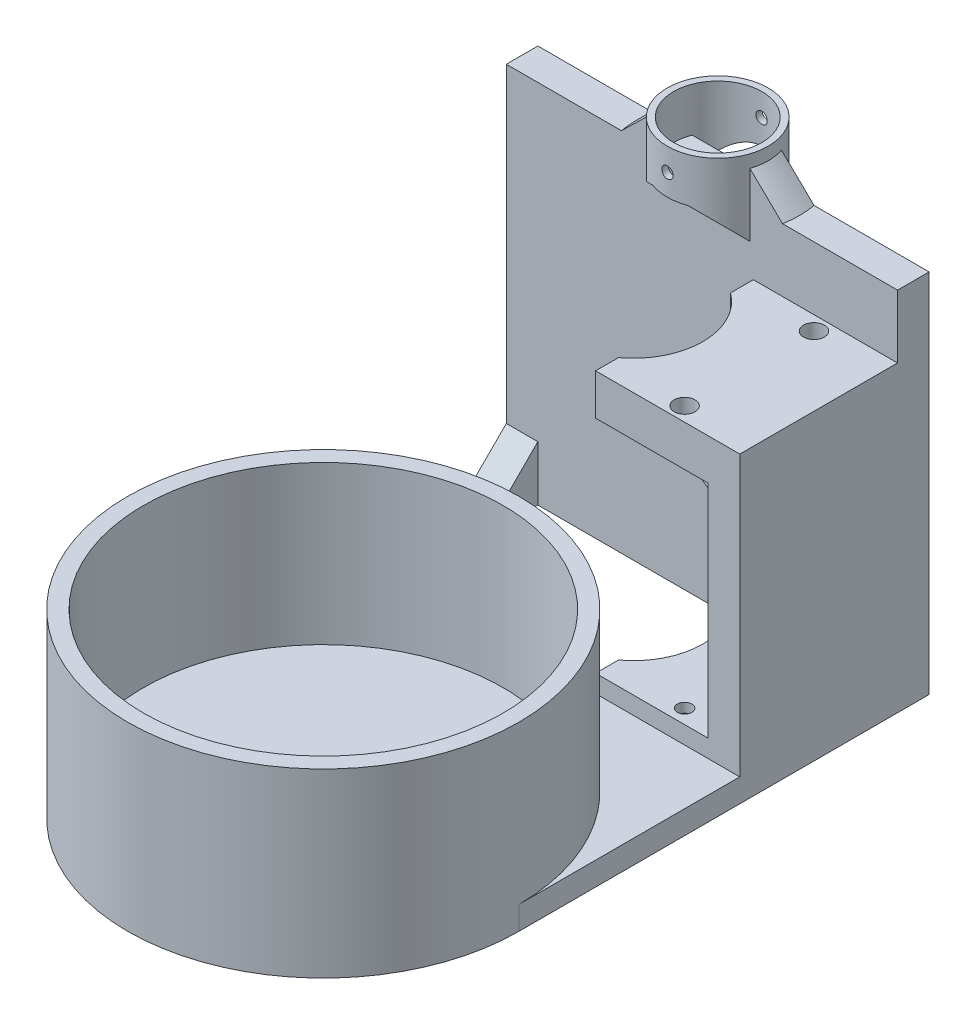
from build123d import *

# Parameters (mm, degrees)
SKETCH1_W               = 62
SKETCH1_H               = 48
BOSS_EXTRUDE1_DEPTH     = 5
SKETCH2_R               = 1.65
CUT_EXTRUDE2_DEPTH      = 5
SKETCH3_R               = 11
SKETCH3_R_2             = 1.65
BOSS_EXTRUDE2_DEPTH     = 2
SKETCH4_R               = 9.6
CUT_EXTRUDE4_DEPTH      = 5
SKETCH5_W               = 5
SKETCH5_H               = 35
BOSS_EXTRUDE3_DEPTH     = 25
CUT_EXTRUDE5_DEPTH      = 60.860253925
CUT_EXTRUDE5_DEPTH_BACK = 25
SKETCH6_R               = 1.15
SKETCH7_R               = 1.65
CUT_EXTRUDE6_DEPTH      = 5
SKETCH8_R               = 11
CUT_EXTRUDE7_DEPTH      = 65.536811201
SKETCH9_W               = 19
SKETCH9_H               = 60
BOSS_EXTRUDE4_DEPTH     = 3
SKETCH10_W              = 19
SKETCH10_H              = 55
BOSS_EXTRUDE5_DEPTH     = 3.7
SKETCH11_W              = 5
SKETCH11_H              = 48
BOSS_EXTRUDE6_DEPTH     = 25
BOSS_EXTRUDE7_DEPTH     = 3.7
SKETCH13_R              = 31
SKETCH13_R_2            = 28.5
BOSS_EXTRUDE8_DEPTH     = 25
SKETCH14_W              = 62
SKETCH14_H              = 5
BOSS_EXTRUDE9_DEPTH     = 10
SKETCH15_R              = 8
SKETCH15_R_2            = 7
BOSS_EXTRUDE10_DEPTH    = 7
CHAMFER1_SIZE           = 5
CUT_EXTRUDE8_DEPTH      = 109.894444303
CUT_EXTRUDE8_DEPTH_BACK = 109.894444303
SKETCH16_R              = 0.9
CHAMFER2_SIZE           = 5
SKETCH17_W              = 19
SKETCH17_H              = 60
CUT_EXTRUDE9_DEPTH      = 10
SKETCH18_W              = 30
SKETCH18_H              = 44.3
CUT_EXTRUDE10_DEPTH     = 10
CHAMFER3_SIZE           = 5


with BuildPart() as part:
    # Sketch1 → Boss-Extrude1 (new body)
    with BuildSketch(Plane.XY):
        Rectangle(SKETCH1_W, SKETCH1_H)
    extrude(amount=BOSS_EXTRUDE1_DEPTH)

    # Sketch2 → Cut-Extrude2 (cut)
    with BuildSketch(Plane.XY.offset(5)):
        with Locations((6, 7)):
            Circle(SKETCH2_R)
        with Locations((13, 0)):
            Circle(SKETCH2_R)
        with Locations((6, -7)):
            Circle(SKETCH2_R)
        with Locations((-1, 0)):
            Circle(SKETCH2_R)
    extrude(amount=-CUT_EXTRUDE2_DEPTH, mode=Mode.SUBTRACT)

    # Sketch3 → Boss-Extrude2 (add)
    with BuildSketch(Plane(origin=(0, 0, 0), x_dir=(-1, 0, 0), z_dir=(0, 0, -1))):
        with Locations(Location((-6, 0, 0), (0, 0, 180))):
            Circle(SKETCH3_R)
        with Locations(Location((1, 0, 0), (0, 0, 180))):
            Circle(SKETCH3_R_2, mode=Mode.SUBTRACT)
        with Locations(Location((-6, -7, 0), (0, 0, 180))):
            Circle(SKETCH3_R_2, mode=Mode.SUBTRACT)
        with Locations(Location((-13, 0, 0), (0, 0, 180))):
            Circle(SKETCH3_R_2, mode=Mode.SUBTRACT)
        with Locations(Location((-6, 7, 0), (0, 0, 180))):
            Circle(SKETCH3_R_2, mode=Mode.SUBTRACT)
    extrude(amount=BOSS_EXTRUDE2_DEPTH)

    # Sketch4 → Cut-Extrude4 (cut)
    with BuildSketch(Plane.XY.offset(5)):
        with Locations((6, 0)):
            Circle(SKETCH4_R)
    extrude(amount=-CUT_EXTRUDE4_DEPTH, mode=Mode.SUBTRACT)

    # Sketch5 → Boss-Extrude3 (add)
    with BuildSketch(Plane.XY.offset(5)):
        Polygon((8.15, -17.5), (8.15, -24), (31, -24), (31, -17.5), (26, -17.5), align=None)
        with Locations((28.5, 0)):
            Rectangle(SKETCH5_W, SKETCH5_H)
        Polygon((8.15, 17.5), (26, 17.5), (31, 17.5), (31, 24), (8.15, 24), align=None)
    extrude(amount=BOSS_EXTRUDE3_DEPTH)

    # Sketch6 → Cut-Extrude5 (cut, two sides: drawn at the far end of the back side and taken through both)
    with BuildSketch(Plane(origin=(0, -17.5, 0), x_dir=(1, 0, 0), z_dir=(0, 1, 0)).offset(-CUT_EXTRUDE5_DEPTH_BACK)):
        with Locations((20, -27.75)):
            Circle(SKETCH6_R)
        with Locations((20, -7.25)):
            Circle(SKETCH6_R)
        with Locations((-0.7, -7.25)):
            Circle(SKETCH6_R)
        with Locations((-0.7, -27.75)):
            Circle(SKETCH6_R)
    extrude(amount=CUT_EXTRUDE5_DEPTH + CUT_EXTRUDE5_DEPTH_BACK, mode=Mode.SUBTRACT)

    # Sketch7 → Cut-Extrude6 (cut)
    with BuildSketch(Plane(origin=(0, 24, 0), x_dir=(1, 0, 0), z_dir=(0, 1, 0))):
        with Locations((0.45, -7.25)):
            Circle(SKETCH7_R)
        with Locations(Location((20, -7.25, 0), (0, 0, 270))):
            Circle(SKETCH7_R)
        with Locations(Location((20, -27.75, 0), (0, 0, 270))):
            Circle(SKETCH7_R)
        with Locations((0.45, -27.75)):
            Circle(SKETCH7_R)
    cut_extrude6 = extrude(amount=-CUT_EXTRUDE6_DEPTH, mode=Mode.SUBTRACT)

    # Mirror1: Cut-Extrude6 across plane
    add(cut_extrude6.mirror(Plane.ZX), mode=Mode.SUBTRACT)

    # Sketch8 → Cut-Extrude7 (cut, through all)
    with BuildSketch(Plane(origin=(0, 24, 0), x_dir=(1, 0, 0), z_dir=(0, 1, 0))):
        with Locations((1.65, -17.5)):
            Circle(SKETCH8_R)
    extrude(amount=-CUT_EXTRUDE7_DEPTH, mode=Mode.SUBTRACT)

    # Sketch9 → Boss-Extrude4 (add)
    with BuildSketch(Plane(origin=(0, 24, 0), x_dir=(1, 0, 0), z_dir=(0, 1, 0))):
        with Locations((17.65, -60)):
            Rectangle(SKETCH9_W, SKETCH9_H)
    extrude(amount=-BOSS_EXTRUDE4_DEPTH)

    # Sketch10 → Boss-Extrude5 (add)
    with BuildSketch(Plane(origin=(0, 24, 0), x_dir=(1, 0, 0), z_dir=(0, 1, 0))):
        with Locations((17.65, -62.5)):
            Rectangle(SKETCH10_W, SKETCH10_H)
    extrude(amount=BOSS_EXTRUDE5_DEPTH)

    # Sketch11 → Boss-Extrude6 (add)
    with BuildSketch(Plane.XY.offset(5)):
        with Locations((-28.5, 0)):
            Rectangle(SKETCH11_W, SKETCH11_H)
    extrude(amount=BOSS_EXTRUDE6_DEPTH)

    # Sketch12 → Boss-Extrude7 (add)
    with BuildSketch(Plane.XZ.offset(24)):
        with BuildLine():
            Line((-31, 30), (31, 30))
            Line((31, 30), (31, 65))
            ThreePointArc((31, 65), (0, 96), (-31, 65))
            Line((-31, 65), (-31, 30))
        make_face()
    extrude(amount=-BOSS_EXTRUDE7_DEPTH)

    # Sketch13 → Boss-Extrude8 (add)
    with BuildSketch(Plane(origin=(0, -20.3, 0), x_dir=(1, 0, 0), z_dir=(0, 1, 0))):
        with Locations((0, -65)):
            Circle(SKETCH13_R)
        with Locations(Location((0, -65, 0), (0, 0, 270))):
            Circle(SKETCH13_R_2, mode=Mode.SUBTRACT)
    extrude(amount=BOSS_EXTRUDE8_DEPTH)

    # Sketch14 → Boss-Extrude9 (add)
    with BuildSketch(Plane(origin=(0, 24, 0), x_dir=(1, 0, 0), z_dir=(0, 1, 0))):
        with Locations((0, -2.5)):
            Rectangle(SKETCH14_W, SKETCH14_H)
    extrude(amount=BOSS_EXTRUDE9_DEPTH)

    # Sketch15 → Boss-Extrude10 (add)
    with BuildSketch(Plane(origin=(0, 34, 0), x_dir=(1, 0, 0), z_dir=(0, 1, 0))):
        with Locations(Location((0, -2.5, 0), (0, 0, 18.209956864))):
            Circle(SKETCH15_R)
        with Locations(Location((0, -2.5, 0), (0, 0, 159.075167572))):
            Circle(SKETCH15_R_2, mode=Mode.SUBTRACT)
    extrude(amount=BOSS_EXTRUDE10_DEPTH)

    # Chamfer1
    # the kernel refuses this chamfer: 5 mm, written as the material it adds along each edge
    with BuildSketch(Plane(origin=(0, 34, 2.5), x_dir=(0.34706049300703296, 0, -0.9378427449171398), z_dir=(0.9378427449171398, 0, 0.34706049300703296))) as chamfer1_piece_1_section:
        Polygon((8 + CHAMFER1_SIZE, 0), (8, CHAMFER1_SIZE), (8, 0), align=None)
    chamfer1_piece_1 = revolve(axis=Axis((0, 34, 2.5), (0, 1, 0)), revolution_arc=220.61525354, mode=Mode.PRIVATE)
    chamfer1_piece_1 = split(chamfer1_piece_1, bisect_by=Plane(origin=(-9.551791351, 35.668281916, 5), z_dir=(0, 0, -1)), keep=Keep.TOP, mode=Mode.PRIVATE)
    chamfer1_piece_1 = split(chamfer1_piece_1, bisect_by=Plane(origin=(-9.551791351, 35.668281916, 0), z_dir=(0, 0, 1)), keep=Keep.TOP, mode=Mode.PRIVATE)
    add(chamfer1_piece_1)
    with BuildSketch(Plane(origin=(0, 34, 2.5), x_dir=(-0.3470604930069759, 0, 0.9378427449171609), z_dir=(-0.9378427449171609, 0, -0.3470604930069759))) as chamfer1_piece_2_section:
        Polygon((8 + CHAMFER1_SIZE, 0), (8, CHAMFER1_SIZE), (8, 0), align=None)
    chamfer1_piece_2 = revolve(axis=Axis((0, 34, 2.5), (0, 1, 0)), revolution_arc=220.61525354, mode=Mode.PRIVATE)
    chamfer1_piece_2 = split(chamfer1_piece_2, bisect_by=Plane(origin=(9.551791351, 35.668281916, 5), z_dir=(0, 0, -1)), keep=Keep.TOP, mode=Mode.PRIVATE)
    chamfer1_piece_2 = split(chamfer1_piece_2, bisect_by=Plane(origin=(9.551791351, 35.668281916, 0), z_dir=(0, 0, 1)), keep=Keep.TOP, mode=Mode.PRIVATE)
    add(chamfer1_piece_2)

    # Sketch16 → Cut-Extrude8 (cut, two sides: drawn at the far end of the back side and taken through both)
    with BuildSketch(Plane(origin=(0, 0, 0), x_dir=(-1, 0, 0), z_dir=(0, 0, -1)).offset(-CUT_EXTRUDE8_DEPTH_BACK)):
        with Locations((0, 37.406113714)):
            Circle(SKETCH16_R)
    extrude(amount=CUT_EXTRUDE8_DEPTH + CUT_EXTRUDE8_DEPTH_BACK, mode=Mode.SUBTRACT)

    # Chamfer2
    # the kernel refuses this chamfer: 5 mm, written as the material it adds along each edge
    with BuildSketch(Plane(origin=(6.320066525, 34, 5), x_dir=(0, -0.9996219169112968, -0.027495876610586317), z_dir=(-1, 0, 0))) as chamfer2_piece_1_section:
        Polygon((CHAMFER2_SIZE * 0.999621916911, CHAMFER2_SIZE * 0.0274958766106), (-CHAMFER2_SIZE * 0.0274958766106, CHAMFER2_SIZE * 0.999621916911), (0, 0), align=None)
    chamfer2_piece_1 = extrude(amount=26.777823541, mode=Mode.PRIVATE)
    chamfer2_piece_1 = chamfer2_piece_1 & Plane(origin=(0, 31.52085101, 2.5), x_dir=(0.94991775959971, 0, -0.31249999999530786), z_dir=(0, -1, 0)) * Cylinder(8, 74, mode=Mode.PRIVATE)
    chamfer2_piece_1 = chamfer2_piece_1 - Plane(origin=(0, 31.52085101, 2.5), x_dir=(-0.9340497736136041, 0, -0.3571428571487537), z_dir=(0, -1, 0)) * Cylinder(7, 74, mode=Mode.PRIVATE)
    add(chamfer2_piece_1)
    with BuildSketch(Plane(origin=(20.457757017, 34, 5), x_dir=(0, -0.9996219169112968, -0.027495876610586317), z_dir=(-1, 0, 0))) as chamfer2_piece_2_section:
        Polygon((CHAMFER2_SIZE * 0.999621916911, CHAMFER2_SIZE * 0.0274958766106), (-CHAMFER2_SIZE * 0.0274958766106, CHAMFER2_SIZE * 0.999621916911), (0, 0), align=None)
    chamfer2_piece_2 = extrude(amount=26.777823541, mode=Mode.PRIVATE)
    chamfer2_piece_2 = chamfer2_piece_2 & Plane(origin=(0, 31.52085101, 2.5), x_dir=(0.94991775959971, 0, -0.31249999999530786), z_dir=(0, -1, 0)) * Cylinder(8, 74, mode=Mode.PRIVATE)
    chamfer2_piece_2 = chamfer2_piece_2 - Plane(origin=(0, 31.52085101, 2.5), x_dir=(-0.9340497736136041, 0, -0.3571428571487537), z_dir=(0, -1, 0)) * Cylinder(7, 74, mode=Mode.PRIVATE)
    add(chamfer2_piece_2)
    with BuildSketch(Plane(origin=(-6.320066525, 34, 0), x_dir=(0, -0.9996219169112968, 0.027495876610586372), z_dir=(1, 0, 0))) as chamfer2_piece_3_section:
        Polygon((CHAMFER2_SIZE * 0.999621916911, CHAMFER2_SIZE * 0.0274958766106), (-CHAMFER2_SIZE * 0.0274958766106, CHAMFER2_SIZE * 0.999621916911), (0, 0), align=None)
    chamfer2_piece_3 = extrude(amount=26.777823541, mode=Mode.PRIVATE)
    chamfer2_piece_3 = chamfer2_piece_3 & Plane(origin=(0, 31.52085101, 2.5), x_dir=(0.94991775959971, 0, -0.31249999999530786), z_dir=(0, -1, 0)) * Cylinder(8, 74, mode=Mode.PRIVATE)
    chamfer2_piece_3 = chamfer2_piece_3 - Plane(origin=(0, 31.52085101, 2.5), x_dir=(-0.9340497736136041, 0, -0.3571428571487537), z_dir=(0, -1, 0)) * Cylinder(7, 74, mode=Mode.PRIVATE)
    add(chamfer2_piece_3)
    with BuildSketch(Plane(origin=(-20.457757017, 34, 0), x_dir=(0, -0.9996219169112968, 0.027495876610586372), z_dir=(1, 0, 0))) as chamfer2_piece_4_section:
        Polygon((CHAMFER2_SIZE * 0.999621916911, CHAMFER2_SIZE * 0.0274958766106), (-CHAMFER2_SIZE * 0.0274958766106, CHAMFER2_SIZE * 0.999621916911), (0, 0), align=None)
    chamfer2_piece_4 = extrude(amount=26.777823541, mode=Mode.PRIVATE)
    chamfer2_piece_4 = chamfer2_piece_4 & Plane(origin=(0, 31.52085101, 2.5), x_dir=(0.94991775959971, 0, -0.31249999999530786), z_dir=(0, -1, 0)) * Cylinder(8, 74, mode=Mode.PRIVATE)
    chamfer2_piece_4 = chamfer2_piece_4 - Plane(origin=(0, 31.52085101, 2.5), x_dir=(-0.9340497736136041, 0, -0.3571428571487537), z_dir=(0, -1, 0)) * Cylinder(7, 74, mode=Mode.PRIVATE)
    add(chamfer2_piece_4)
    with BuildSketch(Plane(origin=(-31, -20.3, 30), x_dir=(0, -0.027495876610586317, 0.9996219169112968), z_dir=(1, 0, 0))) as chamfer2_piece_5:
        Polygon((CHAMFER2_SIZE * 0.999621916911, -CHAMFER2_SIZE * 0.0274958766106), (-CHAMFER2_SIZE * 0.0274958766106, -CHAMFER2_SIZE * 0.999621916911), (0, 0), align=None)
    extrude(amount=5)

    # Sketch17 → Cut-Extrude9 (cut)
    with BuildSketch(Plane(origin=(0, 27.7, 0), x_dir=(1, 0, 0), z_dir=(0, 1, 0))):
        with Locations((17.65, -60)):
            Rectangle(SKETCH17_W, SKETCH17_H)
    extrude(amount=-CUT_EXTRUDE9_DEPTH, mode=Mode.SUBTRACT)

    # Sketch18 → Cut-Extrude10 (cut)
    with BuildSketch(Plane.ZY.offset(31)):
        with Locations((20, 1.85)):
            Rectangle(SKETCH18_W, SKETCH18_H)
    extrude(amount=-CUT_EXTRUDE10_DEPTH, mode=Mode.SUBTRACT)

    # Chamfer3
    chamfer3_edges = [part.edges().sort_by_distance(p)[0] for p in [
        (-28.5, -20.3, 5),
    ]]
    chamfer(chamfer3_edges, length=CHAMFER3_SIZE)


solid = part.part
